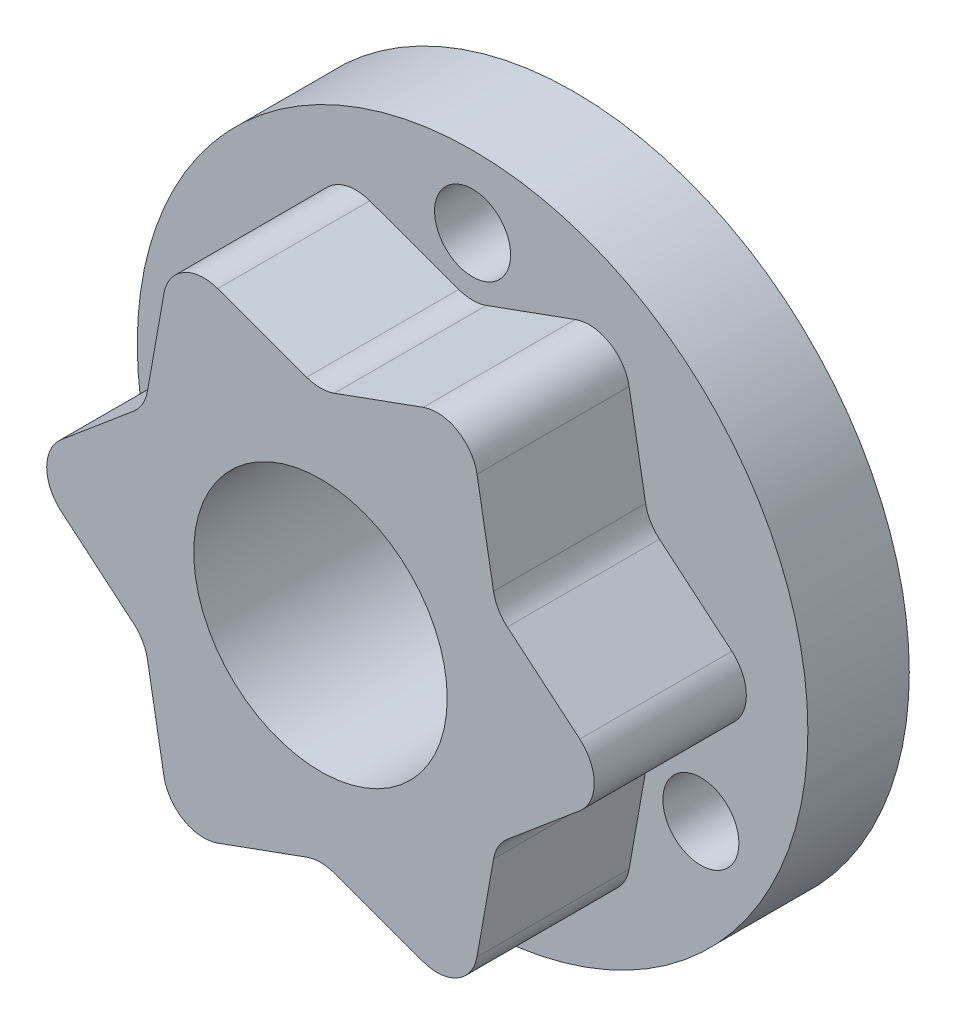
from build123d import *

# Parameters (mm, degrees)
SKETCH1_R           = 21
SKETCH1_R_2         = 7.9375
SKETCH1_R_3         = 2.38125
BOSS_EXTRUDE1_DEPTH = 6.35
SKETCH3_R           = 7.9375
BOSS_EXTRUDE2_DEPTH = 9.525


with BuildPart() as part:
    # Sketch1 → Boss-Extrude1 (new body)
    with BuildSketch(Plane.XY):
        Circle(SKETCH1_R)
        Circle(SKETCH1_R_2, mode=Mode.SUBTRACT)
        with Locations((0, 16.51)):
            Circle(SKETCH1_R_3, mode=Mode.SUBTRACT)
        with Locations((14.298079416, -8.255)):
            Circle(SKETCH1_R_3, mode=Mode.SUBTRACT)
        with Locations((-14.298079416, -8.255)):
            Circle(SKETCH1_R_3, mode=Mode.SUBTRACT)
    extrude(amount=BOSS_EXTRUDE1_DEPTH)

    # Sketch3 → Boss-Extrude2 (add)
    with BuildSketch(Plane.XY.offset(6.35)):
        with BuildLine():
            Line((0.866574922, 13.014521345), (6.435925078, 15.035903984))
            ThreePointArc((6.435925078, 15.035903984), (8.5725, 14.848005548), (9.80351228, 13.091626607))
            Line((9.80351228, 13.091626607), (10.837618642, 7.257736569))
            ThreePointArc((10.837618642, 7.257736569), (11.138926397, 6.431062154), (11.704193564, 5.756784776))
            Line((11.704193564, 5.756784776), (16.239437358, 1.944277378))
            ThreePointArc((16.239437358, 1.944277378), (17.145, 0), (16.239437358, -1.944277378))
            Line((16.239437358, -1.944277378), (11.704193564, -5.756784776))
            ThreePointArc((11.704193564, -5.756784776), (11.138926397, -6.431062154), (10.837618642, -7.257736569))
            Line((10.837618642, -7.257736569), (9.80351228, -13.091626607))
            ThreePointArc((9.80351228, -13.091626607), (8.5725, -14.848005548), (6.435925078, -15.035903984))
            Line((6.435925078, -15.035903984), (0.866574922, -13.014521345))
            ThreePointArc((0.866574922, -13.014521345), (0, -12.862124307), (-0.866574922, -13.014521345))
            Line((-0.866574922, -13.014521345), (-6.435925078, -15.035903984))
            ThreePointArc((-6.435925078, -15.035903984), (-8.5725, -14.848005548), (-9.80351228, -13.091626607))
            Line((-9.80351228, -13.091626607), (-10.837618642, -7.257736569))
            ThreePointArc((-10.837618642, -7.257736569), (-11.138926397, -6.431062154), (-11.704193564, -5.756784776))
            Line((-11.704193564, -5.756784776), (-16.239437358, -1.944277378))
            ThreePointArc((-16.239437358, -1.944277378), (-17.145, 0), (-16.239437358, 1.944277378))
            Line((-16.239437358, 1.944277378), (-11.704193564, 5.756784776))
            ThreePointArc((-11.704193564, 5.756784776), (-11.138926397, 6.431062154), (-10.837618642, 7.257736569))
            Line((-10.837618642, 7.257736569), (-9.80351228, 13.091626607))
            ThreePointArc((-9.80351228, 13.091626607), (-8.5725, 14.848005548), (-6.435925078, 15.035903984))
            Line((-6.435925078, 15.035903984), (-0.866574922, 13.014521345))
            ThreePointArc((-0.866574922, 13.014521345), (0, 12.862124307), (0.866574922, 13.014521345))
        make_face()
        Circle(SKETCH3_R, mode=Mode.SUBTRACT)
    extrude(amount=BOSS_EXTRUDE2_DEPTH)


solid = part.part
